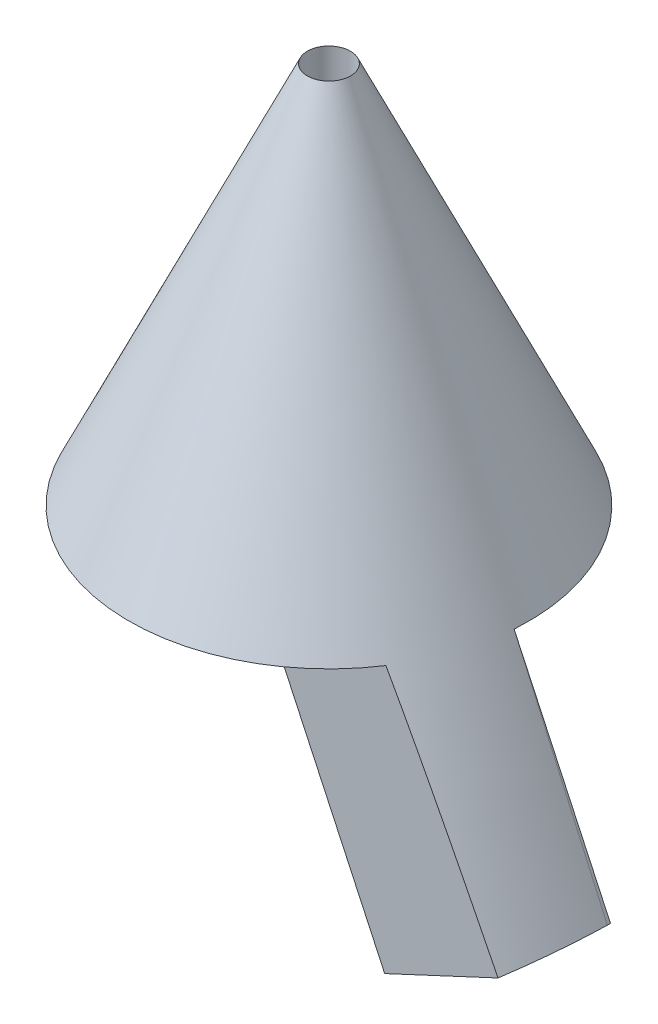
from build123d import *

# Parameters (mm, degrees)
SKETCH4_W           = 9.539179917
SKETCH4_H           = 12.2
BOSS_EXTRUDE1_DEPTH = 3
BOSS_EXTRUDE2_DEPTH = 10


with BuildPart() as part:
    # Sketch3 → Revolve1 (revolve)
    with BuildSketch(Plane.XY):
        Polygon((2.25, 0), (2.25, 40), (20.902306326, 0), align=None)
    revolve(axis=Axis((0, 21.429426471, 0), (0, -1, 0)))

    # Sketch4 → Boss-Extrude1 (add)
    with BuildSketch(Plane.XY.offset(0.5)):
        with Locations((8.440410041, -6.1)):
            Rectangle(SKETCH4_W, SKETCH4_H)
    boss_extrude1 = extrude(amount=BOSS_EXTRUDE1_DEPTH)

    # Mirror1: Boss-Extrude1 across plane
    add(boss_extrude1.mirror(Plane.XY))

    # Sketch9 → Boss-Extrude2 (add)
    with BuildSketch(Plane.XY.offset(1.5)):
        Polygon((20.848415042, 0), (30.918910085, -21.596246313), (17.324293279, -27.935520239), (4.297746257, 0), align=None)
    extrude(amount=BOSS_EXTRUDE2_DEPTH)

    # Sketch10 → Cut-Revolve1 (revolve, cut)
    with BuildSketch(Plane.XY):
        Polygon((2.25, 40), (33.928853348, -27.935520239), (33.928853348, 40), align=None)
    revolve(axis=Axis((0, 55, 0), (0, -1, 0)), mode=Mode.SUBTRACT)


solid = part.part
